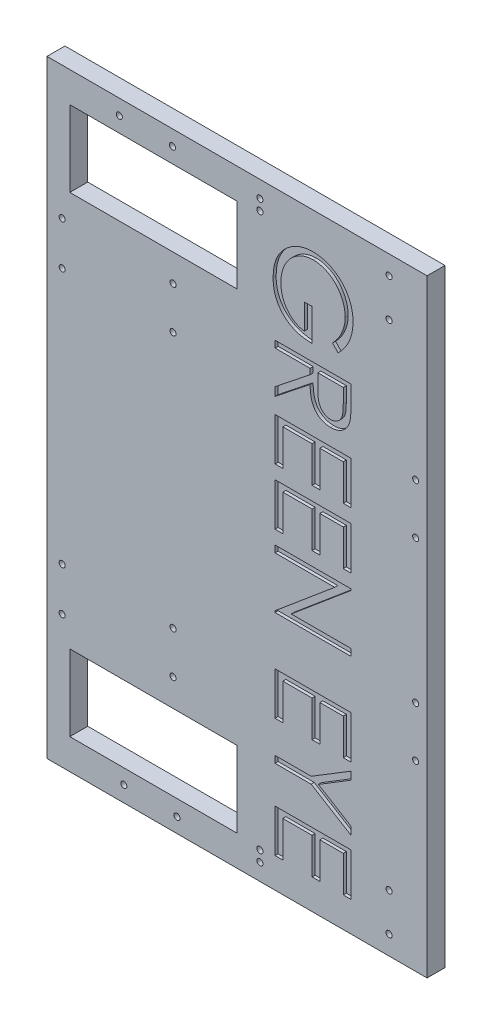
from build123d import *

# Parameters (mm, degrees)
SKETCH1_W           = 250
SKETCH1_H           = 400
SKETCH1_R           = 2
SKETCH1_W_2         = 110
SKETCH1_H_2         = 50
BOSS_EXTRUDE1_DEPTH = 11.8
SKETCH3_R           = 2
CUT_EXTRUDE2_DEPTH  = 532.638260474
CUT_EXTRUDE3_DEPTH  = 2


with BuildPart() as part:
    # Sketch1 → Boss-Extrude1 (new body)
    with BuildSketch(Plane.XY):
        with Locations((-225, -200)):
            Rectangle(SKETCH1_W, SKETCH1_H)
        with Locations((-125, -387.5)):
            Circle(SKETCH1_R, mode=Mode.SUBTRACT)
        with Locations((-125, -362.5)):
            Circle(SKETCH1_R, mode=Mode.SUBTRACT)
        with Locations((-280, -45)):
            Rectangle(SKETCH1_W_2, SKETCH1_H_2, mode=Mode.SUBTRACT)
        with Locations((-280, -355)):
            Rectangle(SKETCH1_W_2, SKETCH1_H_2, mode=Mode.SUBTRACT)
        with Locations((-125, -37.5)):
            Circle(SKETCH1_R, mode=Mode.SUBTRACT)
        with Locations((-125, -12.5)):
            Circle(SKETCH1_R, mode=Mode.SUBTRACT)
    extrude(amount=BOSS_EXTRUDE1_DEPTH)

    # Sketch3 → Cut-Extrude2 (cut, through all)
    with BuildSketch(Plane(origin=(0, 0, 0), x_dir=(-1, 0, 0), z_dir=(0, 0, -1))):
        with Locations((267.09015188, -284.25)):
            Circle(SKETCH3_R)
        with Locations((267.09015188, -312)):
            Circle(SKETCH3_R)
        with Locations((340, -284.25)):
            Circle(SKETCH3_R)
        with Locations((340, -312.75)):
            Circle(SKETCH3_R)
        with Locations((264.480156007, -390.366625774)):
            Circle(SKETCH3_R)
        with Locations((299.47289904, -389.653930177)):
            Circle(SKETCH3_R)
        with Locations((267.09015188, -115.75)):
            Circle(SKETCH3_R)
        with Locations((267.09015188, -88)):
            Circle(SKETCH3_R)
        with Locations((340, -87.25)):
            Circle(SKETCH3_R)
        with Locations((340, -115.75)):
            Circle(SKETCH3_R)
        with Locations((302.440733956, -10)):
            Circle(SKETCH3_R)
        with Locations((267.440733956, -10)):
            Circle(SKETCH3_R)
        with Locations((209.924783741, -389)):
            Circle(SKETCH3_R)
        with Locations((209.924783741, -382)):
            Circle(SKETCH3_R)
        with Locations((107.5, -280)):
            Circle(SKETCH3_R)
        with Locations((107.5, -247)):
            Circle(SKETCH3_R)
        with Locations((107.5, -153)):
            Circle(SKETCH3_R)
        with Locations((107.5, -120)):
            Circle(SKETCH3_R)
        with Locations((209.924783741, -18)):
            Circle(SKETCH3_R)
        with Locations((209.924783741, -11)):
            Circle(SKETCH3_R)
    extrude(amount=-CUT_EXTRUDE2_DEPTH, mode=Mode.SUBTRACT)

    # Sketch5 → Cut-Extrude3 (cut)
    # profile 1 of 8: a face of its own
    with BuildSketch(Plane.XY.offset(11.8)):
        with BuildLine():
            Line((-158.533653846, -73.205128205), (-162.179487179, -69.358974359))
            add(Edge.make_bspline(
                [(-162.179487179, -69.358974359), (-161.525879735, -68.658774926), (-160.237720334, -67.278789907), (-158.545036117, -65.043550955), (-157.120453766, -62.698862144), (-155.941171092, -60.279597337), (-155.008752822, -57.82894386), (-154.348483727, -55.386209292), (-153.92085931, -52.977766878), (-153.870847883, -51.378572945), (-153.846153846, -50.588942308)],
                knots=[0, 0, 0, 0, 1.09204548, 2.152253107, 3.191356492, 4.216655925, 5.218178745, 6.177092199, 7.099906635, 8, 8, 8, 8], degree=3))
            add(Edge.make_bspline(
                [(-153.846153846, -50.588942308), (-153.852071228, -50.104449314), (-153.863890644, -49.13671988), (-154.014392423, -47.699223064), (-154.231520863, -46.276994468), (-154.54245084, -44.874938603), (-154.946296327, -43.487481085), (-155.433879455, -42.117708369), (-156.020825769, -40.768264495), (-156.689997433, -39.44624715), (-157.420511574, -38.15806595), (-158.235239517, -36.946509543), (-159.109161983, -35.806596682), (-160.053547144, -34.746128247), (-161.053385523, -33.751540674), (-162.122281434, -32.835756457), (-163.252476511, -31.994182246), (-164.443866375, -31.236515962), (-165.669368438, -30.560016115), (-166.917804197, -29.961626926), (-168.187872473, -29.464198587), (-169.472216861, -29.051408539), (-170.773515213, -28.728016773), (-172.091801582, -28.496651001), (-173.431575785, -28.367134607), (-174.328666986, -28.344641125), (-174.779647436, -28.333333333)],
                knots=[0, 0, 0, 0, 1.028345126, 2.054023193, 3.065714254, 4.082262095, 5.100859654, 6.132352297, 7.167492809, 8.223256921, 9.277568108, 10.309840045, 11.320860232, 12.32524711, 13.322830633, 14.313234294, 15.3114222, 16.312425732, 17.308799391, 18.282312954, 19.249923241, 20.202773571, 21.145015718, 22.094907699, 23.042283124, 24, 24, 24, 24], degree=3))
            add(Edge.make_bspline(
                [(-174.779647436, -28.333333333), (-175.240633371, -28.344225509), (-176.161346443, -28.365980118), (-177.535931846, -28.502548115), (-178.887466726, -28.763950523), (-180.23098697, -29.085958253), (-181.549087107, -29.534438138), (-182.856527377, -30.063218531), (-184.141346594, -30.697094935), (-185.395728135, -31.428630092), (-186.617450435, -32.231402703), (-187.768310124, -33.130559567), (-188.86357587, -34.085718759), (-189.878944592, -35.131629477), (-190.8415715, -36.234766376), (-191.724936149, -37.428084447), (-192.546053611, -38.68811964), (-193.29457532, -40.016794084), (-193.963268686, -41.399690979), (-194.557895773, -42.817644594), (-195.047600592, -44.275184817), (-195.446716363, -45.764651812), (-195.773863467, -47.284269978), (-195.984327471, -48.841752874), (-196.137053627, -50.425648708), (-196.148220342, -51.493343452), (-196.153846154, -52.03125)],
                knots=[0, 0, 0, 0, 0.935842715, 1.869129955, 2.799583258, 3.728257868, 4.6712142, 5.62263184, 6.589468525, 7.576334199, 8.568768874, 9.554260682, 10.538610026, 11.516240982, 12.510802173, 13.508383516, 14.52719334, 15.561971611, 16.601598616, 17.64369662, 18.68095744, 19.719943675, 20.77263142, 21.833597991, 22.908562741, 24, 24, 24, 24], degree=3))
            add(Edge.make_bspline(
                [(-196.153846154, -52.03125), (-196.140295065, -52.679512106), (-196.113685301, -53.952480072), (-195.906538287, -55.82371493), (-195.583012749, -57.620901793), (-195.109213915, -59.338989915), (-194.504876823, -60.979977724), (-193.77636717, -62.549870259), (-192.895767424, -64.036347199), (-191.90179749, -65.443728808), (-190.794653552, -66.740598146), (-189.598973985, -67.908725785), (-188.326457275, -68.935489777), (-186.965863776, -69.812349207), (-185.538950389, -70.567757882), (-184.020306595, -71.17016331), (-182.427150455, -71.636140839), (-181.325750537, -71.826760072), (-180.769230769, -71.923076923)],
                knots=[0, 0, 0, 0, 1.13011591, 2.219166196, 3.278784489, 4.311187005, 5.322345388, 6.325022048, 7.324448642, 8.33076908, 9.325913853, 10.293360401, 11.241630175, 12.171712957, 13.111744789, 14.052245185, 15.015830637, 16, 16, 16, 16], degree=3))
            Line((-180.769230769, -71.923076923), (-180.769230769, -55.256410256))
            Line((-180.769230769, -55.256410256), (-175.641025641, -55.256410256))
            Line((-175.641025641, -55.256410256), (-175.641025641, -76.41025641))
            add(Edge.make_bspline(
                [(-175.641025641, -76.41025641), (-176.59684691, -76.385887148), (-178.467561792, -76.338192099), (-181.195708518, -76.003636161), (-183.772446994, -75.463400271), (-186.200490875, -74.725395816), (-188.476399343, -73.770034669), (-190.602483145, -72.607569977), (-192.565007158, -71.219396819), (-194.379992923, -69.65496194), (-195.998981669, -67.899248257), (-197.421923639, -65.999696543), (-198.62053243, -63.953168424), (-199.59568475, -61.761599746), (-200.35674182, -59.432164982), (-200.896335773, -56.959473843), (-201.219620964, -54.346879547), (-201.260926384, -52.556355592), (-201.282051282, -51.640625)],
                knots=[0, 0, 0, 0, 1.140356446, 2.231883559, 3.274166699, 4.278491846, 5.25512956, 6.21435461, 7.1637429, 8.11826594, 9.068280886, 10.0076534, 10.945064095, 11.891975133, 12.864533718, 13.863980011, 14.907571808, 16, 16, 16, 16], degree=3))
            add(Edge.make_bspline(
                [(-201.282051282, -51.640625), (-201.273920979, -51.076194495), (-201.2578854, -49.962955626), (-201.143923294, -48.31879951), (-200.96848649, -46.719976359), (-200.703556154, -45.166719089), (-200.379061095, -43.653314201), (-199.963536541, -42.187320131), (-199.482555122, -40.763152387), (-198.935474072, -39.378609735), (-198.301593263, -38.046259067), (-197.597169841, -36.760165967), (-196.825836116, -35.513221314), (-195.974252606, -34.313918957), (-195.048788889, -33.156010079), (-194.047590047, -32.046960884), (-192.973716908, -30.980562626), (-192.211159628, -30.312556004), (-191.826923077, -29.975961538)],
                knots=[0, 0, 0, 0, 1.107784379, 2.184907829, 3.233506516, 4.263428166, 5.276301166, 6.270063455, 7.25232949, 8.225834625, 9.190232166, 10.146266622, 11.1027726, 12.066435141, 13.031522626, 14.010570082, 14.99756817, 16, 16, 16, 16], degree=3))
            add(Edge.make_bspline(
                [(-191.826923077, -29.975961538), (-191.21734232, -29.487591082), (-190.008299217, -28.518956616), (-188.071157154, -27.272125807), (-186.065416295, -26.209248624), (-183.985493032, -25.346851165), (-181.833332849, -24.673449931), (-179.611685831, -24.190503464), (-177.317691109, -23.907542189), (-175.765330185, -23.866777369), (-174.979967949, -23.846153846)],
                knots=[0, 0, 0, 0, 1.023165419, 2.029347347, 3.013907458, 3.994755782, 4.975994455, 5.96558838, 6.970761222, 8, 8, 8, 8], degree=3))
            add(Edge.make_bspline(
                [(-174.979967949, -23.846153846), (-174.391884809, -23.85377785), (-173.223192706, -23.868928961), (-171.487997338, -24.051847535), (-169.784042052, -24.315858705), (-168.109748674, -24.698268302), (-166.472552076, -25.20142501), (-164.859865584, -25.805691284), (-163.278159722, -26.513479927), (-161.74136031, -27.33936424), (-160.250342287, -28.238620225), (-158.850753829, -29.248743054), (-157.518380841, -30.319993219), (-156.277357582, -31.482657999), (-155.122279649, -32.730150902), (-154.04886728, -34.055564398), (-153.054376972, -35.458250784), (-152.154823973, -36.943073931), (-151.346767898, -38.487749562), (-150.638351752, -40.088608217), (-150.052875502, -41.745152256), (-149.556107308, -43.444973474), (-149.188748133, -45.200937739), (-148.922337491, -47.00030256), (-148.740043208, -48.852447015), (-148.725382411, -50.104390292), (-148.717948718, -50.739182692)],
                knots=[0, 0, 0, 0, 1.009014138, 2.005204323, 2.991638015, 3.967544938, 4.950092358, 5.929358695, 6.922031709, 7.921874511, 8.922406847, 9.908357674, 10.882125353, 11.855201406, 12.82437151, 13.798139189, 14.780770167, 15.773426639, 16.775664355, 17.771244468, 18.775446331, 19.789330884, 20.808771541, 21.851841802, 22.910785716, 24, 24, 24, 24], degree=3))
            add(Edge.make_bspline(
                [(-148.717948718, -50.739182692), (-148.726206482, -51.256875674), (-148.742580657, -52.283400022), (-148.856664125, -53.810855066), (-149.035481358, -55.31169338), (-149.285527314, -56.793443754), (-149.616297569, -58.250464302), (-150.019410799, -59.687169344), (-150.486138024, -61.100841575), (-151.043201836, -62.489799213), (-151.675374579, -63.863485602), (-152.387000922, -65.229510593), (-153.190213607, -66.583214467), (-154.087407435, -67.926942673), (-155.063170418, -69.269169243), (-156.145410792, -70.588664126), (-157.291450151, -71.917277617), (-158.115481351, -72.771589249), (-158.533653846, -73.205128205)],
                knots=[0, 0, 0, 0, 0.985875312, 1.954874891, 2.915472732, 3.863573565, 4.815313299, 5.759461513, 6.704487138, 7.649063459, 8.607849844, 9.583336382, 10.581114205, 11.603942397, 12.659508253, 13.739925933, 14.853076422, 16, 16, 16, 16], degree=3))
        make_face()
    # profile 2 of 8: a face of its own
    with BuildSketch(Plane.XY.offset(11.8)):
        with BuildLine():
            Line((-150, -86.666666667), (-150, -96.672676282))
            add(Edge.make_bspline(
                [(-150, -96.672676282), (-150.002222657, -97.340406689), (-150.006490405, -98.622523038), (-150.030287018, -100.459284043), (-150.098492099, -102.128242572), (-150.157186149, -103.628525991), (-150.264213882, -104.960106776), (-150.366508841, -106.127068072), (-150.500418281, -107.12403518), (-150.624781466, -107.727547341), (-150.681089744, -108.000801282)],
                knots=[0, 0, 0, 0, 1.410062039, 2.707475311, 3.878576406, 4.937260626, 5.877586885, 6.699081471, 7.410979367, 8, 8, 8, 8], degree=3))
            add(Edge.make_bspline(
                [(-150.681089744, -108.000801282), (-150.771461853, -108.366616642), (-150.950278188, -109.090443526), (-151.328421238, -110.132493848), (-151.765295649, -111.125900496), (-152.282403622, -112.066935506), (-152.870725679, -112.955686177), (-153.53369917, -113.790821805), (-154.274700369, -114.567567683), (-155.074807223, -115.291900491), (-155.941000907, -115.948484871), (-156.860663324, -116.516672744), (-157.828042525, -117.003209167), (-158.846507281, -117.391625826), (-159.907448149, -117.70409512), (-161.020129139, -117.924490146), (-162.179576093, -118.056644391), (-162.970402747, -118.07010024), (-163.371394231, -118.076923077)],
                knots=[0, 0, 0, 0, 1.02737288, 2.032829108, 3.019628684, 3.985738875, 4.958353778, 5.924249254, 6.890702889, 7.883913451, 8.865824512, 9.85161466, 10.829249435, 11.81541824, 12.821369441, 13.843154991, 14.906364023, 16, 16, 16, 16], degree=3))
            add(Edge.make_bspline(
                [(-163.371394231, -118.076923077), (-164.037610778, -118.055937934), (-165.337571815, -118.014990486), (-167.224145126, -117.633195683), (-168.984031637, -117.007844649), (-170.614782196, -116.145980886), (-172.085468199, -115.048939116), (-173.372850655, -113.730544372), (-174.460103794, -112.197529603), (-175.206055276, -110.763693108), (-175.686032431, -109.496516194), (-176.025441464, -108.450235196), (-176.283255417, -107.308052852), (-176.517572278, -106.086355505), (-176.696374867, -104.775706642), (-176.823358688, -103.378745587), (-176.905010251, -101.89197846), (-176.916939894, -100.872839007), (-176.923076923, -100.348557692)],
                knots=[0, 0, 0, 0, 1.260402266, 2.459371274, 3.627181936, 4.786749125, 5.93865593, 7.087644312, 8.261344208, 9.485713728, 10.136162886, 10.825977872, 11.566646758, 12.35154167, 13.181268117, 14.0701832, 15.007234106, 16, 16, 16, 16], degree=3))
            Line((-176.923076923, -100.348557692), (-200, -118.717948718))
            Line((-200, -118.717948718), (-200, -113.169070513))
            Line((-200, -113.169070513), (-176.923076923, -94.799679487))
            Line((-176.923076923, -94.799679487), (-176.923076923, -91.153846154))
            Line((-176.923076923, -91.153846154), (-200, -91.153846154))
            Line((-200, -91.153846154), (-200, -86.666666667))
            Line((-200, -86.666666667), (-150, -86.666666667))
        make_face()
        with BuildLine():
            Line((-155.128205128, -91.153846154), (-171.794871795, -91.153846154))
            Line((-171.794871795, -91.153846154), (-171.864983974, -100.30849359))
            add(Edge.make_bspline(
                [(-171.864983974, -100.30849359), (-171.865173068, -100.735922715), (-171.865539585, -101.564402099), (-171.808485658, -102.762983049), (-171.743581048, -103.878984563), (-171.644304894, -104.908138439), (-171.516360322, -105.850902903), (-171.35631994, -106.706811733), (-171.169854569, -107.477245793), (-170.881290812, -108.375836528), (-170.423853112, -109.378943893), (-169.759450917, -110.470458796), (-168.918370558, -111.396818415), (-167.971893909, -112.195519954), (-166.909859812, -112.810723561), (-165.779407957, -113.258483852), (-164.590297907, -113.539478385), (-163.77355728, -113.572884664), (-163.361378205, -113.58974359)],
                knots=[0, 0, 0, 0, 1.14660753, 2.222451964, 3.218720504, 4.145691244, 4.995719623, 5.770487122, 6.480909919, 7.121111896, 8.299844659, 9.430703709, 10.534634535, 11.641396424, 12.741395289, 13.810956493, 14.895269934, 16, 16, 16, 16], degree=3))
            add(Edge.make_bspline(
                [(-163.361378205, -113.58974359), (-162.959172788, -113.572832842), (-162.162148414, -113.53932191), (-160.998527893, -113.257939415), (-159.892429872, -112.803547824), (-158.864937316, -112.166385653), (-157.924480288, -111.396472894), (-157.13092433, -110.48208701), (-156.466367466, -109.469277595), (-156.044793987, -108.521988706), (-155.785814707, -107.67587219), (-155.603798076, -106.941127812), (-155.45632881, -106.107773955), (-155.341674243, -105.177807788), (-155.238498234, -104.152911775), (-155.171601642, -103.030279551), (-155.131169331, -101.811207512), (-155.12921619, -100.966247766), (-155.128205128, -100.528846154)],
                knots=[0, 0, 0, 0, 1.100801541, 2.181386982, 3.260112282, 4.364594493, 5.481957178, 6.577424609, 7.668452592, 8.790448866, 9.403819393, 10.091598921, 10.863153553, 11.720938239, 12.658472417, 13.685008818, 14.801622349, 16, 16, 16, 16], degree=3))
            Line((-155.128205128, -100.528846154), (-155.128205128, -91.153846154))
        make_face(mode=Mode.SUBTRACT)
    # profile 3 of 8: a face of its own
    with BuildSketch(Plane.XY.offset(11.8)):
        Polygon((-150, -128.974358974), (-150, -157.179487179), (-155.128205128, -157.179487179), (-155.128205128, -133.461538462), (-170.512820513, -133.461538462), (-170.512820513, -157.179487179), (-175.641025641, -157.179487179), (-175.641025641, -133.461538462), (-194.871794872, -133.461538462), (-194.871794872, -157.179487179), (-200, -157.179487179), (-200, -128.974358974), align=None)
    # profile 4 of 8: a face of its own
    with BuildSketch(Plane.XY.offset(11.8)):
        Polygon((-150, -166.153846154), (-150, -194.358974359), (-155.128205128, -194.358974359), (-155.128205128, -170.641025641), (-170.512820513, -170.641025641), (-170.512820513, -194.358974359), (-175.641025641, -194.358974359), (-175.641025641, -170.641025641), (-194.871794872, -170.641025641), (-194.871794872, -194.358974359), (-200, -194.358974359), (-200, -166.153846154), align=None)
    # profile 5 of 8: a face of its own
    with BuildSketch(Plane.XY.offset(11.8)):
        Polygon((-200, -203.333333333), (-150, -203.333333333), (-150, -204.274839744), (-189.352964744, -237.307692308), (-150, -237.307692308), (-150, -241.794871795), (-200, -241.794871795), (-200, -240.773237179), (-160.737179487, -207.820512821), (-200, -207.820512821), align=None)
    # profile 6 of 8: a face of its own
    with BuildSketch(Plane.XY.offset(11.8)):
        Polygon((-150, -273.846153846), (-150, -302.051282051), (-155.128205128, -302.051282051), (-155.128205128, -278.333333333), (-170.512820513, -278.333333333), (-170.512820513, -302.051282051), (-175.641025641, -302.051282051), (-175.641025641, -278.333333333), (-194.871794872, -278.333333333), (-194.871794872, -302.051282051), (-200, -302.051282051), (-200, -273.846153846), align=None)
    # profile 7 of 8: a face of its own
    with BuildSketch(Plane.XY.offset(11.8)):
        Polygon((-150, -307.179487179), (-150, -312.317708333), (-171.484375, -325.458733974), (-150, -338.579727564), (-150, -343.717948718), (-176.231971154, -327.692307692), (-200, -327.692307692), (-200, -323.205128205), (-176.231971154, -323.205128205), align=None)
    # profile 8 of 8: a face of its own
    with BuildSketch(Plane.XY.offset(11.8)):
        Polygon((-150, -352.051282051), (-150, -380.256410256), (-155.128205128, -380.256410256), (-155.128205128, -356.538461538), (-170.512820513, -356.538461538), (-170.512820513, -380.256410256), (-175.641025641, -380.256410256), (-175.641025641, -356.538461538), (-194.871794872, -356.538461538), (-194.871794872, -380.256410256), (-200, -380.256410256), (-200, -352.051282051), align=None)
    extrude(amount=-CUT_EXTRUDE3_DEPTH, mode=Mode.SUBTRACT)


solid = part.part
